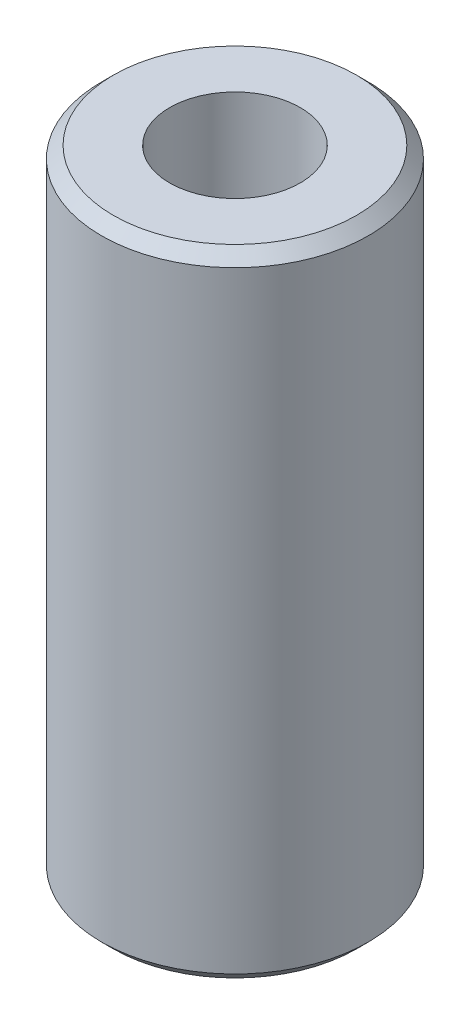
from build123d import *

# Parameters (mm, degrees)
SKETCH1_R           = 45
BOSS_EXTRUDE1_DEPTH = 214.367668515
SKETCH2_R           = 22.045412324
CUT_EXTRUDE1_DEPTH  = 224.614617824
CHAMFER1_SIZE       = 3.975582032


with BuildPart() as part:
    # Sketch1 → Boss-Extrude1 (new body)
    with BuildSketch(Plane(origin=(0, 0, 0), x_dir=(1, 0, 0), z_dir=(0, 1, 0))):
        Circle(SKETCH1_R)
    extrude(amount=BOSS_EXTRUDE1_DEPTH)

    # Sketch2 → Cut-Extrude1 (cut, through all)
    with BuildSketch(Plane(origin=(0, 0, 0), x_dir=(1, 0, 0), z_dir=(0, 1, 0))):
        Circle(SKETCH2_R)
    extrude(amount=CUT_EXTRUDE1_DEPTH, mode=Mode.SUBTRACT)

    # Chamfer1
    chamfer1_edges = [part.edges().sort_by_distance(p)[0] for p in [
        (-45, 214.367668515, 0),
        (-45, 0, 0),
    ]]
    chamfer(chamfer1_edges, length=CHAMFER1_SIZE)


solid = part.part
